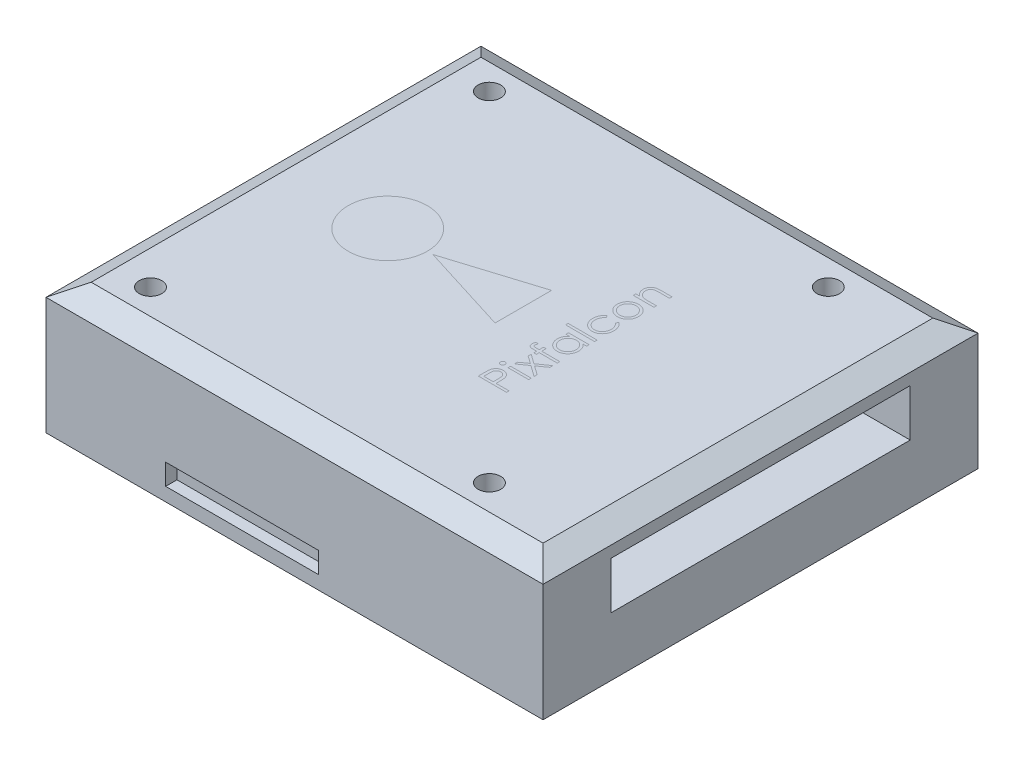
from build123d import *
from OCP.BRepFilletAPI import BRepFilletAPI_MakeChamfer

# Parameters (mm, degrees)
SKETCH1_W           = 44
SKETCH1_H           = 38.5
BOSS_EXTRUDE1_DEPTH = 12.7
CHAMFER1_SIZE       = 2
CHAMFER1_SIZE2      = 1.154700538
SKETCH2_W           = 29
SKETCH2_H           = 3.71
CUT_EXTRUDE1_DEPTH  = 7.5
SKETCH3_W           = 26.5
SKETCH3_H           = 4.18
CUT_EXTRUDE2_DEPTH  = 7.5
SKETCH5_R           = 1
CUT_EXTRUDE3_DEPTH  = 2
SKETCH6_W           = 5.836145695
SKETCH6_H           = 2.652793498
SKETCH6_W_2         = 13.440820391
SKETCH6_H_2         = 3.537057997
CUT_EXTRUDE4_DEPTH  = 2
SKETCH7_W           = 13.529246841
SKETCH7_H           = 1.856955449
CUT_EXTRUDE5_DEPTH  = 1


with BuildPart() as part:
    # Sketch1 → Boss-Extrude1 (new body)
    with BuildSketch(Plane(origin=(0, 0, 0), x_dir=(1, 0, 0), z_dir=(0, 1, 0))):
        Rectangle(SKETCH1_W, SKETCH1_H)
    extrude(amount=BOSS_EXTRUDE1_DEPTH)

    # Chamfer1: one chamfer whose edges measure the first distance from different faces: ONE call of the kernel's chamfer builder (chamfer() names one face for all edges)
    chamfer1_edges_1 = [part.edges().sort_by_distance(p)[0] for p in [
        (0, 0, -19.25),
        (-22, 0, 0),
        (0, 0, 19.25),
        (22, 0, 0),
    ]]
    chamfer1_side_1 = [part.faces().sort_by_distance(p)[0] for p in [
        (0, 0, 0),
    ]]
    chamfer1_edges_2 = [part.edges().sort_by_distance(p)[0] for p in [
        (0, 12.7, 19.25),
        (-22, 12.7, 0),
        (0, 12.7, -19.25),
        (22, 12.7, 0),
    ]]
    chamfer1_side_2 = [part.faces().sort_by_distance(p)[0] for p in [
        (0, 12.7, 0),
    ]]
    chamfer1 = BRepFilletAPI_MakeChamfer(part.part.solid().wrapped)
    for e in chamfer1_edges_1:
        chamfer1.Add(CHAMFER1_SIZE, CHAMFER1_SIZE2, e.wrapped, chamfer1_side_1[0].wrapped)  # the first distance lies on this face
    for e in chamfer1_edges_2:
        chamfer1.Add(CHAMFER1_SIZE, CHAMFER1_SIZE2, e.wrapped, chamfer1_side_2[0].wrapped)  # the first distance lies on this face
    add(Compound.cast(chamfer1.Shape()), mode=Mode.REPLACE)

    # Sketch2 → Cut-Extrude1 (cut)
    with BuildSketch(Plane.ZY.offset(22)):
        with Locations((0, 8.205)):
            Rectangle(SKETCH2_W, SKETCH2_H)
    extrude(amount=-CUT_EXTRUDE1_DEPTH, mode=Mode.SUBTRACT)

    # Sketch3 → Cut-Extrude2 (cut)
    with BuildSketch(Plane(origin=(22, 0, 0), x_dir=(0, 0, -1), z_dir=(1, 0, 0))):
        with Locations((0, 8.44)):
            Rectangle(SKETCH3_W, SKETCH3_H)
    extrude(amount=-CUT_EXTRUDE2_DEPTH, mode=Mode.SUBTRACT)

    # Sketch5 → Cut-Extrude3 (cut)
    with BuildSketch(Plane(origin=(0, 12.7, 0), x_dir=(1, 0, 0), z_dir=(0, 1, 0))):
        with Locations((-17, -15)):
            Circle(SKETCH5_R)
        with Locations((-17, 15)):
            Circle(SKETCH5_R)
        with Locations((13, 15)):
            Circle(SKETCH5_R)
        with Locations((13, -15)):
            Circle(SKETCH5_R)
    extrude(amount=-CUT_EXTRUDE3_DEPTH, mode=Mode.SUBTRACT)

    # Sketch6 → Cut-Extrude4 (cut)
    with BuildSketch(Plane(origin=(0, 0, -19.25), x_dir=(-1, 0, 0), z_dir=(0, 0, -1))):
        with Locations((-2.166448024, 3.719313114)):
            Rectangle(SKETCH6_W, SKETCH6_H)
        with Locations((9.726909494, 7.919569487)):
            Rectangle(SKETCH6_W_2, SKETCH6_H_2)
    extrude(amount=-CUT_EXTRUDE4_DEPTH, mode=Mode.SUBTRACT)

    # Sketch7 → Cut-Extrude5 (cut)
    with BuildSketch(Plane.XY.offset(19.25)):
        with Locations((-4.642388622, 3.277180865)):
            Rectangle(SKETCH7_W, SKETCH7_H)
    extrude(amount=-CUT_EXTRUDE5_DEPTH, mode=Mode.SUBTRACT)


solid = part.part
